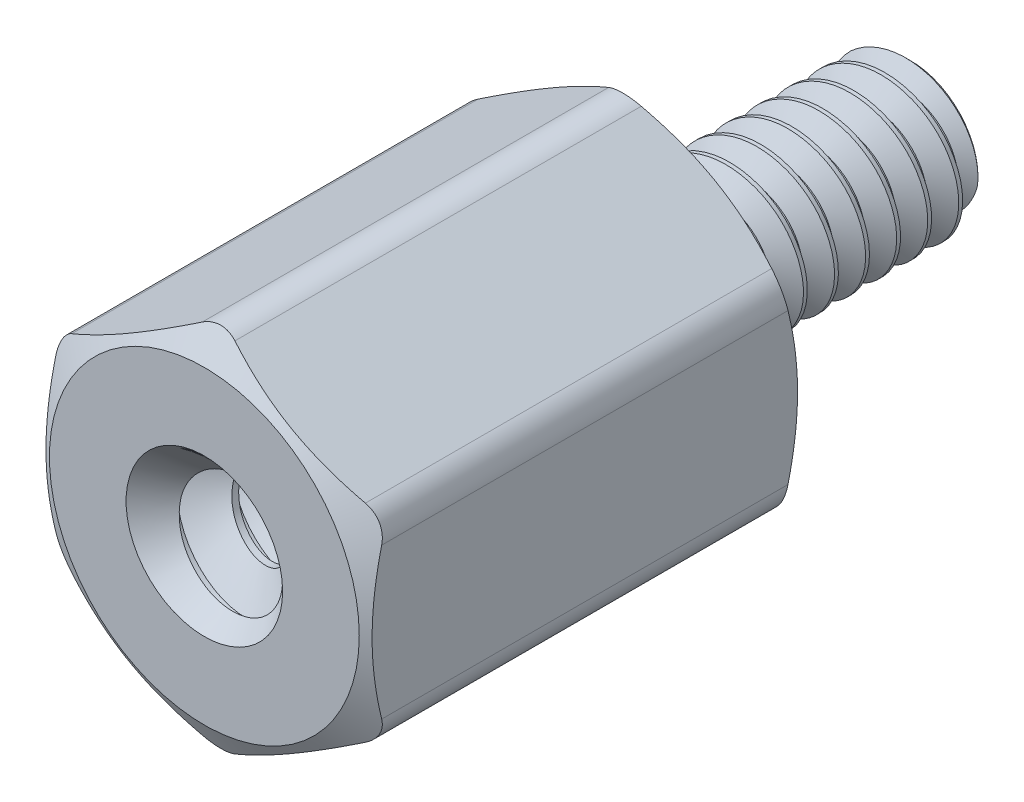
from build123d import *

# Parameters (mm, degrees)
SKETCH4_R           = 1.736725
BOSS_EXTRUDE1_DEPTH = 6.35
SKETCH5_OUTSIDE_W   = 50.652
SKETCH5_OUTSIDE_H   = 51.39
SKETCH5_OUTSIDE_R   = 2.2621875
CUT_EXTRUDE1_DEPTH  = 11.941088697
CUT_EXTRUDE1_DRAFT  = -60
SKETCH6_OUTSIDE_W   = 38.102
SKETCH6_OUTSIDE_H   = 38.84
SKETCH6_OUTSIDE_R   = 2.2621875
CUT_EXTRUDE2_DEPTH  = 8.318013413
CUT_EXTRUDE2_DRAFT  = -60
FILLET1_R           = 0.47625
CUT_SWEEP1_PITCH    = 0.453571429
SKETCH9_R           = 1.205592857
BOSS_EXTRUDE2_DEPTH = 4.7752
SKETCH10_W          = 4.7752
SKETCH10_H          = 1.0922
CUT_SWEEP2_PITCH    = 0.79375


with BuildPart() as part:
    # Sketch3 → Revolve1 (revolve)
    with BuildSketch(Plane(origin=(0, 0, 0), x_dir=(0, 0, -1), z_dir=(1, 0, 0))):
        with BuildLine():
            Line((-1.5748, 0.978807143), (-1.5748, 0))
            Line((-1.5748, 0), (3.96875, 0))
            Line((3.96875, 0), (3.96875, 0.978807143))
            Line((3.96875, 0.978807143), (3.855357143, 1.0922))
            Line((3.855357143, 1.0922), (0.646339286, 1.0922))
            Line((0.646339286, 1.0922), (0.47625, 0.797596715))
            Line((0.47625, 0.797596715), (0.113392857, 0.797596715))
            ThreePointArc((0.113392857, 0.797596715), (0.033211999, 0.830808714), (0, 0.910989572))
            Line((0, 0.910989572), (0, 2.38125))
            Line((0, 2.38125), (-6.35, 2.38125))
            Line((-6.35, 2.38125), (-6.35, 1.205592857))
            Line((-6.35, 1.205592857), (-6.236607143, 1.0922))
            Line((-6.236607143, 1.0922), (-1.688192857, 1.0922))
            Line((-1.688192857, 1.0922), (-1.5748, 0.978807143))
        make_face()
    revolve(axis=Axis((0, 0, -3.96875), (0, 0, 1)))

    # Sketch4 → Boss-Extrude1 (add)
    with BuildSketch(Plane.XY.offset(6.35)):
        Polygon((-2.38125, 1.374815329), (-2.38125, -1.374815329), (0, -2.749630657), (2.38125, -1.374815329), (2.38125, 1.374815329), (0, 2.749630657), align=None)
        Circle(SKETCH4_R, mode=Mode.SUBTRACT)
    extrude(amount=-BOSS_EXTRUDE1_DEPTH)


with BuildPart() as cut_extrude1_tool:
    # Sketch5 outside → Cut-Extrude1 (with draft: the straight prism first)
    with BuildSketch(Plane.XY.offset(6.35)):
        Rectangle(SKETCH5_OUTSIDE_W, SKETCH5_OUTSIDE_H)
        Circle(SKETCH5_OUTSIDE_R, mode=Mode.SUBTRACT)
    extrude(amount=-CUT_EXTRUDE1_DEPTH)
    # Cut-Extrude1: the draft: its side faces are tilted about the plane it starts from
    cut_extrude1_sides = [cut_extrude1_tool.faces().sort_by_distance(p)[0] for p in [
        (0, -25.695, 0.379455652),
        (25.326, 0, 0.379455652),
        (0, 25.695, 0.379455652),
        (-25.326, 0, 0.379455652),
        (-2.2621875, 0, 0.379455652),
    ]]
    draft(cut_extrude1_sides, Plane.XY.offset(6.35), CUT_EXTRUDE1_DRAFT)


with BuildPart() as part_1:
    add(part.part)

    # Cut-Extrude1: cut by cut_extrude1_tool
    add(cut_extrude1_tool.part, mode=Mode.SUBTRACT)


with BuildPart() as cut_extrude2_tool:
    # Sketch6 outside → Cut-Extrude2 (with draft: the straight prism first)
    with BuildSketch(Plane(origin=(0, 0, 0), x_dir=(-1, 0, 0), z_dir=(0, 0, -1))):
        Rectangle(SKETCH6_OUTSIDE_W, SKETCH6_OUTSIDE_H)
        Circle(SKETCH6_OUTSIDE_R, mode=Mode.SUBTRACT)
    extrude(amount=-CUT_EXTRUDE2_DEPTH)
    # Cut-Extrude2: the draft: its side faces are tilted about the plane it starts from
    cut_extrude2_sides = [cut_extrude2_tool.faces().sort_by_distance(p)[0] for p in [
        (0, -19.42, 4.159006706),
        (-19.051, 0, 4.159006706),
        (0, 19.42, 4.159006706),
        (19.051, 0, 4.159006706),
        (2.2621875, 0, 4.159006706),
    ]]
    draft(cut_extrude2_sides, Plane(origin=(0, 0, 0), x_dir=(-1, 0, 0), z_dir=(0, 0, -1)), CUT_EXTRUDE2_DRAFT)


with BuildPart() as part_2:
    add(part_1.part)

    # Cut-Extrude2: cut by cut_extrude2_tool
    add(cut_extrude2_tool.part, mode=Mode.SUBTRACT)

    # Fillet1
    fillet1_edges = [part_2.edges().sort_by_distance(p)[0] for p in [
        (0, 2.749630657, 3.175),
        (-2.38125, -1.374815329, 3.175),
        (0, -2.749630657, 3.175),
        (2.38125, -1.374815329, 3.175),
        (2.38125, 1.374815329, 3.175),
        (-2.38125, 1.374815329, 3.175),
    ]]
    fillet(fillet1_edges, radius=FILLET1_R)

    # Cut-Sweep1: the profile of Sketch7 profile screwed along a right-hand helix of 8.4875 turns, 6 arcs to a turn; built about Z, then put on its axis
    cut_sweep1_z = Axis((0, 0, 0), (0, 0, 1))
    cut_sweep1_corners = [(0.797296715, 0, -0.170262491), (0.797296715, 0, -0.226612509), (1.116750274, 0, -0.411049107), (1.116750274, 0, 0.014174107)]
    with BuildLine(mode=Mode.PRIVATE) as cut_sweep1_profile:
        Line(cut_sweep1_corners[0], cut_sweep1_corners[1])
        Line(cut_sweep1_corners[1], cut_sweep1_corners[2])
        Line(cut_sweep1_corners[2], cut_sweep1_corners[3])
        Line(cut_sweep1_corners[3], cut_sweep1_corners[0])
    cut_sweep1_cap = Face(cut_sweep1_profile.wire())
    cut_sweep1_turn_angles = [0, 30, 60, 90, 120, 150, 180, 210, 240, 270, 300, 330, 360]
    cut_sweep1_turn_weights = [1, 0.8660254037844387, 1, 0.8660254037844387, 1, 0.8660254037844387, 1, 0.8660254037844387, 1, 0.8660254037844387, 1, 0.8660254037844387, 1]
    cut_sweep1_turn_rails = [Edge.make_bspline([Vector(p[0], p[1], 0).rotate(cut_sweep1_z, cut_sweep1_turn_angles[k]) / cut_sweep1_turn_weights[k] + Vector(0, 0, p[2] + CUT_SWEEP1_PITCH * cut_sweep1_turn_angles[k] / 360) for k in range(13)], [0, 0, 0, 1, 1, 2, 2, 3, 3, 4, 4, 5, 5, 6, 6, 6], 2, cut_sweep1_turn_weights) for p in cut_sweep1_corners]
    cut_sweep1_turn_sides = [Face.make_surface_from_curves(cut_sweep1_turn_rails[p[0]], cut_sweep1_turn_rails[p[1]]) for p in [(0, 1), (1, 2), (2, 3), (3, 0)]]
    cut_sweep1_last_angles = [2880, 2910, 2940, 2970, 3000, 3027.75, 3055.5]
    cut_sweep1_last_weights = [1, 0.8660254037844387, 1, 0.8660254037844387, 1, 0.8849876374631269, 1]
    cut_sweep1_last_rails = [Edge.make_bspline([Vector(p[0], p[1], 0).rotate(cut_sweep1_z, cut_sweep1_last_angles[k]) / cut_sweep1_last_weights[k] + Vector(0, 0, p[2] + CUT_SWEEP1_PITCH * cut_sweep1_last_angles[k] / 360) for k in range(7)], [0, 0, 0, 1, 1, 2, 2, 3, 3, 3], 2, cut_sweep1_last_weights) for p in cut_sweep1_corners]
    cut_sweep1_last_sides = [Face.make_surface_from_curves(cut_sweep1_last_rails[p[0]], cut_sweep1_last_rails[p[1]]) for p in [(0, 1), (1, 2), (2, 3), (3, 0)]]
    cut_sweep1 = Plane(origin=(0, 0, -3.96875), x_dir=(0, 1, 0), z_dir=(0, 0, 1)) * Solid(Shell([*[p.moved(Location((0, 0, CUT_SWEEP1_PITCH * i))) for i in range(8) for p in cut_sweep1_turn_sides], *cut_sweep1_last_sides, cut_sweep1_cap, cut_sweep1_cap.rotate(cut_sweep1_z, 3055.5).moved(Location((0, 0, CUT_SWEEP1_PITCH * 3055.5 / 360)))]))
    add(cut_sweep1, mode=Mode.SUBTRACT)

    # Sketch9 → Boss-Extrude2 (add)
    with BuildSketch(Plane.XY.offset(1.5748)):
        Circle(SKETCH9_R)
    extrude(amount=BOSS_EXTRUDE2_DEPTH)


with BuildPart() as body_2:
    # Sketch10 → Revolve2 (revolve)
    with BuildSketch(Plane(origin=(0, 0, 0), x_dir=(0, 0, -1), z_dir=(1, 0, 0))):
        with Locations((-3.9624, 0.5461)):
            Rectangle(SKETCH10_W, SKETCH10_H)
    revolve(axis=Axis((0, 0, -3.96875), (0, 0, 1)))

    # Cut-Sweep2: the profile of Sketch12 screwed along a right-hand helix of 7.016 turns, 8 arcs to a turn; built about Z, then put on its axis
    cut_sweep2_z = Axis((0, 0, 0), (0, 0, 1))
    cut_sweep2_corners = [(0.576644252, 0, -0.396875), (0.576644252, 0, -0.29765625), (1.135162979, 0, 0.024804687), (1.135162979, 0, -0.719335937)]
    with BuildLine(mode=Mode.PRIVATE) as cut_sweep2_profile:
        Line(cut_sweep2_corners[0], cut_sweep2_corners[1])
        Line(cut_sweep2_corners[1], cut_sweep2_corners[2])
        Line(cut_sweep2_corners[2], cut_sweep2_corners[3])
        Line(cut_sweep2_corners[3], cut_sweep2_corners[0])
    cut_sweep2_cap = Face(cut_sweep2_profile.wire())
    cut_sweep2_turn_angles = [0, 22.5, 45, 67.5, 90, 112.5, 135, 157.5, 180, 202.5, 225, 247.5, 270, 292.5, 315, 337.5, 360]
    cut_sweep2_turn_weights = [1, 0.9238795325112867, 1, 0.9238795325112867, 1, 0.9238795325112867, 1, 0.9238795325112867, 1, 0.9238795325112867, 1, 0.9238795325112867, 1, 0.9238795325112867, 1, 0.9238795325112867, 1]
    cut_sweep2_turn_rails = [Edge.make_bspline([Vector(p[0], p[1], 0).rotate(cut_sweep2_z, cut_sweep2_turn_angles[k]) / cut_sweep2_turn_weights[k] + Vector(0, 0, p[2] + CUT_SWEEP2_PITCH * cut_sweep2_turn_angles[k] / 360) for k in range(17)], [0, 0, 0, 1, 1, 2, 2, 3, 3, 4, 4, 5, 5, 6, 6, 7, 7, 8, 8, 8], 2, cut_sweep2_turn_weights) for p in cut_sweep2_corners]
    cut_sweep2_turn_sides = [Face.make_surface_from_curves(cut_sweep2_turn_rails[p[0]], cut_sweep2_turn_rails[p[1]]) for p in [(0, 1), (1, 2), (2, 3), (3, 0)]]
    cut_sweep2_last_angles = [2520, 2522.88, 2525.76]
    cut_sweep2_last_weights = [1, 0.9987369566060156, 1]
    cut_sweep2_last_rails = [Edge.make_bspline([Vector(p[0], p[1], 0).rotate(cut_sweep2_z, cut_sweep2_last_angles[k]) / cut_sweep2_last_weights[k] + Vector(0, 0, p[2] + CUT_SWEEP2_PITCH * cut_sweep2_last_angles[k] / 360) for k in range(3)], [0, 0, 0, 1, 1, 1], 2, cut_sweep2_last_weights) for p in cut_sweep2_corners]
    cut_sweep2_last_sides = [Face.make_surface_from_curves(cut_sweep2_last_rails[p[0]], cut_sweep2_last_rails[p[1]]) for p in [(0, 1), (1, 2), (2, 3), (3, 0)]]
    cut_sweep2 = Plane(origin=(0, 0, 6.35), x_dir=(0, 1, 0), z_dir=(0, 0, -1)) * Solid(Shell([*[p.moved(Location((0, 0, CUT_SWEEP2_PITCH * i))) for i in range(7) for p in cut_sweep2_turn_sides], *cut_sweep2_last_sides, cut_sweep2_cap, cut_sweep2_cap.rotate(cut_sweep2_z, 2525.76).moved(Location((0, 0, CUT_SWEEP2_PITCH * 2525.76 / 360)))]))
    add(cut_sweep2, mode=Mode.SUBTRACT)


with BuildPart() as part_3:
    add(part_2.part)

    # Combine1: cut body 2
    add(body_2.part, mode=Mode.SUBTRACT)

    # Cut-Extrude3 cone 1 section (through the dimple's axis) → Cut-Extrude3 (revolve, cut)
    with BuildSketch(Plane(origin=(0, 0, 6.35), x_dir=(0, -1, 0), z_dir=(1, 0, 0))):
        Polygon((0, 0), (1.143, 0), (0, 1.143), align=None)
    revolve(axis=Axis((0, 0, 6.35), (0, 0, -1)), mode=Mode.SUBTRACT)


solid = part_3.part
